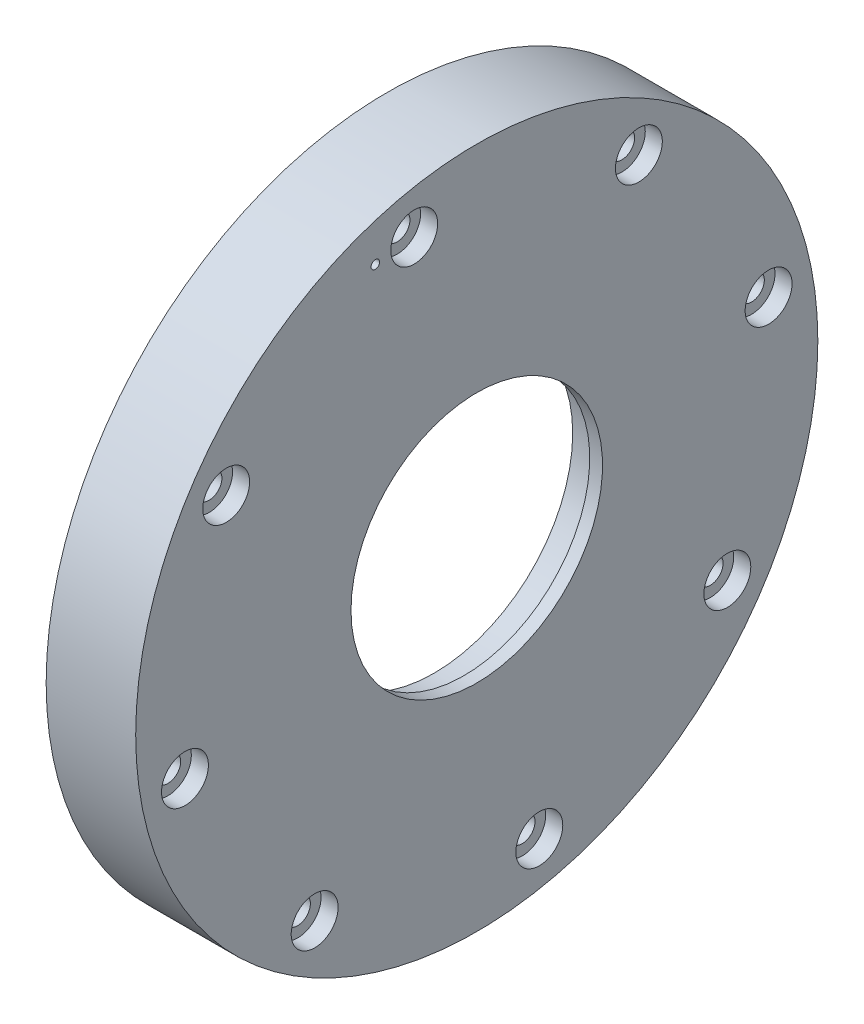
from build123d import *

# Parameters (mm, degrees)
SKETCH3_R          = 2.51
CUT_EXTRUDE1_DEPTH = 4
SKETCH4_R          = 5.5
CUT_EXTRUDE2_DEPTH = 4
SKETCH5_R          = 3
CUT_EXTRUDE3_DEPTH = 116.06954419
SKETCH8_R          = 1
CUT_EXTRUDE6_DEPTH = 2


with BuildPart() as part:
    # Sketch2 → Revolve1 (revolve)
    with BuildSketch(Plane.XY):
        Polygon((0, 80), (0, 52.5), (11, 52.5), (11, 32.5), (18, 32.5), (18, 29.5), (21, 29.5), (21, 80), align=None)
    revolve(axis=Axis((0, 0, 0), (1, 0, 0)))

    # Sketch3 → Cut-Extrude1 (cut)
    with BuildSketch(Plane.ZY):
        with Locations((0, 60)):
            Circle(SKETCH3_R)
        with Locations((12.077911205, 58.771796475)):
            Circle(SKETCH3_R)
        with Locations((23.661351307, 55.137468697)):
            Circle(SKETCH3_R)
        with Locations((34.276092906, 49.245806472)):
            Circle(SKETCH3_R)
        with Locations((43.487567234, 41.338015145)):
            Circle(SKETCH3_R)
        with Locations((50.91865545, 31.73784062)):
            Circle(SKETCH3_R)
        with Locations((56.265127929, 20.838315171)):
            Circle(SKETCH3_R)
        with Locations((59.30809946, 9.08566665)):
            Circle(SKETCH3_R)
        with Locations((59.92299043, -3.03895013)):
            Circle(SKETCH3_R)
        with Locations((58.084627132, -15.039151936)):
            Circle(SKETCH3_R)
        with Locations((53.868272374, -26.423649093)):
            Circle(SKETCH3_R)
        with Locations((47.446544216, -36.726358953)):
            Circle(SKETCH3_R)
        with Locations((39.082348963, -45.525487362)):
            Circle(SKETCH3_R)
        with Locations((29.118117752, -52.460796969)):
            Circle(SKETCH3_R)
        with Locations((17.961787378, -57.248355384)):
            Circle(SKETCH3_R)
        with Locations((6.070099319, -59.692159404)):
            Circle(SKETCH3_R)
        with Locations((-6.070099319, -59.692159404)):
            Circle(SKETCH3_R)
        with Locations((-17.961787378, -57.248355384)):
            Circle(SKETCH3_R)
        with Locations((-29.118117752, -52.460796969)):
            Circle(SKETCH3_R)
        with Locations((-39.082348963, -45.525487362)):
            Circle(SKETCH3_R)
        with Locations((-47.446544216, -36.726358953)):
            Circle(SKETCH3_R)
        with Locations((-53.868272374, -26.423649093)):
            Circle(SKETCH3_R)
        with Locations((-58.084627132, -15.039151936)):
            Circle(SKETCH3_R)
        with Locations((-59.92299043, -3.03895013)):
            Circle(SKETCH3_R)
        with Locations((-59.30809946, 9.08566665)):
            Circle(SKETCH3_R)
        with Locations((-56.265127929, 20.838315171)):
            Circle(SKETCH3_R)
        with Locations((-50.91865545, 31.73784062)):
            Circle(SKETCH3_R)
        with Locations((-43.487567234, 41.338015145)):
            Circle(SKETCH3_R)
        with Locations((-34.276092906, 49.245806472)):
            Circle(SKETCH3_R)
        with Locations((-23.661351307, 55.137468697)):
            Circle(SKETCH3_R)
        with Locations((-12.077911205, 58.771796475)):
            Circle(SKETCH3_R)
    extrude(amount=-CUT_EXTRUDE1_DEPTH, mode=Mode.SUBTRACT)

    # Sketch4 → Cut-Extrude2 (cut)
    with BuildSketch(Plane(origin=(21, 0, 0), x_dir=(0, 0, -1), z_dir=(1, 0, 0))):
        with Locations((-38.025520434, -58.771249738)):
            Circle(SKETCH4_R)
        with Locations((-68.445652585, -14.669445872)):
            Circle(SKETCH4_R)
        with Locations((-58.771249738, 38.025520434)):
            Circle(SKETCH4_R)
        with Locations((-14.669445872, 68.445652585)):
            Circle(SKETCH4_R)
        with Locations((38.025520434, 58.771249738)):
            Circle(SKETCH4_R)
        with Locations((68.445652585, 14.669445872)):
            Circle(SKETCH4_R)
        with Locations((58.771249738, -38.025520434)):
            Circle(SKETCH4_R)
        with Locations((14.669445872, -68.445652585)):
            Circle(SKETCH4_R)
    extrude(amount=-CUT_EXTRUDE2_DEPTH, mode=Mode.SUBTRACT)

    # Sketch5 → Cut-Extrude3 (cut, through all)
    with BuildSketch(Plane(origin=(21, 0, 0), x_dir=(0, 0, -1), z_dir=(1, 0, 0))):
        with Locations((-38.025520434, -58.771249738)):
            Circle(SKETCH5_R)
        with Locations((-68.445652585, -14.669445872)):
            Circle(SKETCH5_R)
        with Locations((-58.771249738, 38.025520434)):
            Circle(SKETCH5_R)
        with Locations((-14.669445872, 68.445652585)):
            Circle(SKETCH5_R)
        with Locations((38.025520434, 58.771249738)):
            Circle(SKETCH5_R)
        with Locations((68.445652585, 14.669445872)):
            Circle(SKETCH5_R)
        with Locations((58.771249738, -38.025520434)):
            Circle(SKETCH5_R)
        with Locations((14.669445872, -68.445652585)):
            Circle(SKETCH5_R)
    extrude(amount=-CUT_EXTRUDE3_DEPTH, mode=Mode.SUBTRACT)

    # Sketch8 → Cut-Extrude6 (cut)
    with BuildSketch(Plane(origin=(21, 0, 0), x_dir=(0, 0, -1), z_dir=(1, 0, 0))):
        with Locations((-23.796606953, 67.435072873)):
            Circle(SKETCH8_R)
    extrude(amount=-CUT_EXTRUDE6_DEPTH, mode=Mode.SUBTRACT)


solid = part.part
